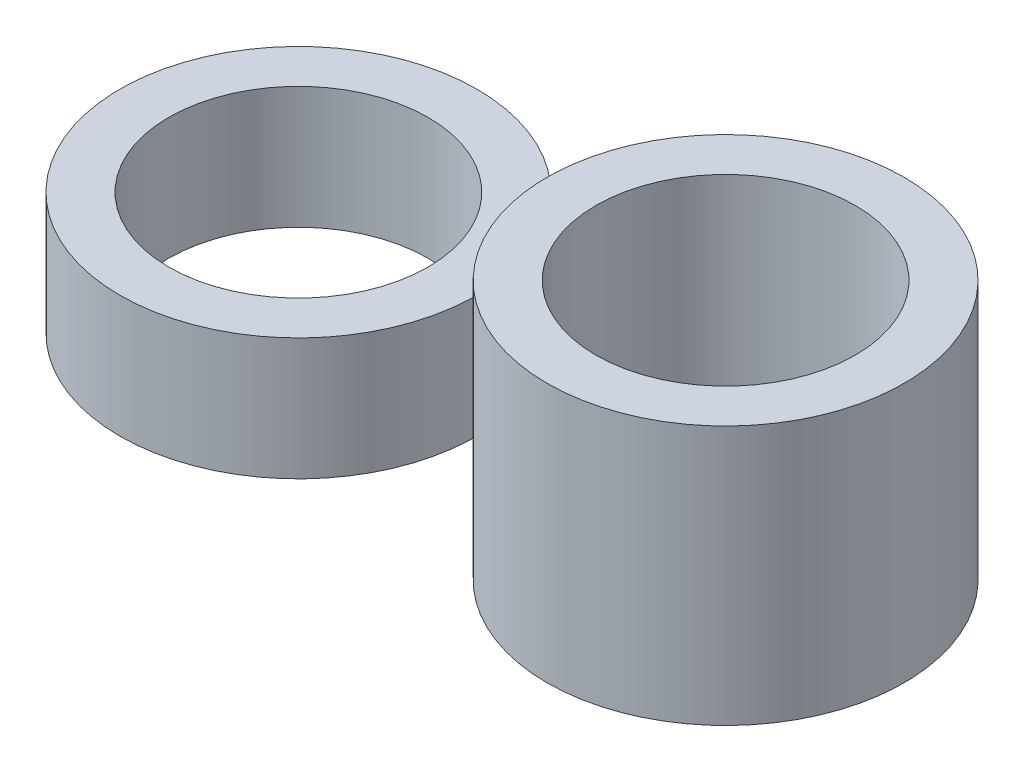
from build123d import *

# Parameters (mm, degrees)
SKETCH1_R           = 5.85
SKETCH1_R_2         = 4.25
BOSS_EXTRUDE1_DEPTH = 8.5
SKETCH2_R           = 5.85
SKETCH2_R_2         = 4.25
BOSS_EXTRUDE2_DEPTH = 4


with BuildPart() as part:
    # Sketch1 → Boss-Extrude1 (new body)
    with BuildSketch(Plane(origin=(0, 0, 0), x_dir=(1, 0, 0), z_dir=(0, 1, 0))):
        Circle(SKETCH1_R)
        Circle(SKETCH1_R_2, mode=Mode.SUBTRACT)
    extrude(amount=BOSS_EXTRUDE1_DEPTH)


with BuildPart() as body_2:
    # Sketch2 → Boss-Extrude2 (new body)
    with BuildSketch(Plane(origin=(0, 0, 0), x_dir=(1, 0, 0), z_dir=(0, 1, 0))):
        with Locations((-14, 0)):
            Circle(SKETCH2_R)
        with Locations((-14, 0)):
            Circle(SKETCH2_R_2, mode=Mode.SUBTRACT)
    extrude(amount=BOSS_EXTRUDE2_DEPTH)


solid = Compound([part.part, body_2.part])
